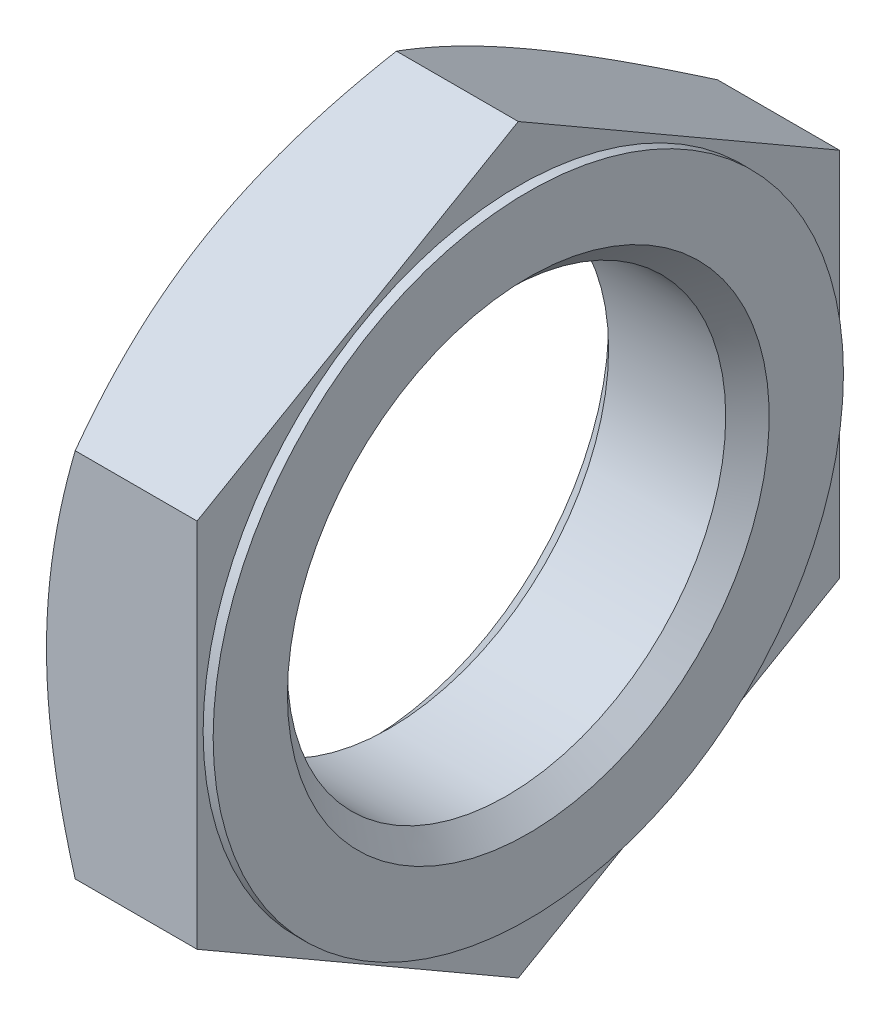
from build123d import *

# Parameters (mm, degrees)
SKETCH_3_W          = 64
SKETCH_3_H          = 64
CUT_EXTRUDE_1_DEPTH = 8


with BuildPart() as part:
    # 草图1 → 旋转1 (revolve)
    with BuildSketch(Plane.XY):
        Polygon((0, 0), (0, 16), (1.443375673, 18.5), (7.5, 18.5), (7.5, 15.7), (8, 15.7), (8, 0), align=None)
    revolve(axis=Axis((8, 0, 0), (-1, 0, 0)))

    # 草图2 → 切除-旋转1 (revolve, cut)
    with BuildSketch(Plane.XY):
        Polygon((0, 0), (0, 12), (1.0825, 10.9175), (6.9175, 10.9175), (8, 12), (8, 0), align=None)
    revolve(axis=Axis((8, 0, 0), (-1, 0, 0)), mode=Mode.SUBTRACT)

    # 草图3 → 切除-拉伸1 (cut)
    with BuildSketch(Plane(origin=(0, 0, 0), x_dir=(0, 0, -1), z_dir=(1, 0, 0))):
        Rectangle(SKETCH_3_W, SKETCH_3_H)
        Polygon((-16, -9.237604307), (0, -18.475208614), (16, -9.237604307), (16, 9.237604307), (0, 18.475208614), (-16, 9.237604307), align=None, mode=Mode.SUBTRACT)
    extrude(amount=CUT_EXTRUDE_1_DEPTH, mode=Mode.SUBTRACT)


solid = part.part
